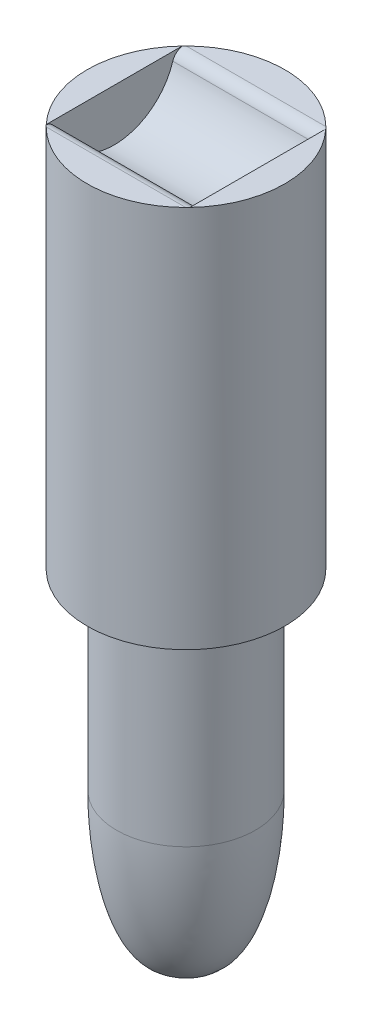
from build123d import *

# Parameters (mm, degrees)
SKETCH1_R               = 1.45
BOSS_EXTRUDE1_DEPTH     = 7
SKETCH3_R               = 2.065
BOSS_EXTRUDE3_DEPTH     = 8
FILLET1_SIZE            = 3
FILLET1_SIZE_2          = 1
CUT_EXTRUDE1_DEPTH      = 1.5
CUT_EXTRUDE1_DEPTH_BACK = 1.5
SKETCH5_R               = 1.280712692
FILLET2_R               = 0.25


with BuildPart() as part:
    # Sketch1 → Boss-Extrude1 (new body)
    with BuildSketch(Plane(origin=(0, 0, 0), x_dir=(1, 0, 0), z_dir=(0, 1, 0))):
        with Locations(Location((0, 0, 0), (0, 0, 270))):
            Circle(SKETCH1_R)
    extrude(amount=BOSS_EXTRUDE1_DEPTH)

    # Sketch3 → Boss-Extrude3 (add)
    with BuildSketch(Plane(origin=(0, 7, 0), x_dir=(1, 0, 0), z_dir=(0, 1, 0))):
        with Locations(Location((0, 0, 0), (0, 0, 270))):
            Circle(SKETCH3_R)
    extrude(amount=BOSS_EXTRUDE3_DEPTH)

    # Fillet1
    # an asymmetric fillet: 3, 1 mm, written as the material it takes off along each edge
    with BuildSketch(Plane(origin=(0, 0, 0), x_dir=(0, 0, 1), z_dir=(-1, 0, 0))) as fillet1_piece_1:
        with BuildLine():
            Bezier((1.45, FILLET1_SIZE), (1.45, 0), (1.45 - FILLET1_SIZE_2, 0), weights=[1, 0.707106781, 1])
            Line((1.45 - FILLET1_SIZE_2, 0), (1.45, 0))
            Line((1.45, 0), (1.45, FILLET1_SIZE))
        make_face()
    revolve(axis=Axis((0, 0, 0), (0, 1, 0)), mode=Mode.SUBTRACT)

    # Sketch5 → Cut-Extrude1 (cut, two sides: drawn at the far end of the back side and taken through both)
    with BuildSketch(Plane(origin=(0, 0, 0), x_dir=(0, 0, -1), z_dir=(1, 0, 0)).offset(-CUT_EXTRUDE1_DEPTH_BACK)):
        with Locations((0, 15.2)):
            Circle(SKETCH5_R)
    extrude(amount=CUT_EXTRUDE1_DEPTH + CUT_EXTRUDE1_DEPTH_BACK, mode=Mode.SUBTRACT)

    # Fillet2
    # the kernel refuses this fillet: 0.25 mm, written as the material it takes off along each edge
    with BuildSketch(Plane(origin=(1.5, 15, 1.265), x_dir=(0, 0, 1), z_dir=(-1, 0, 0)), Plane(origin=(-1.5, 15, -1.265), x_dir=(0, 0, -1), z_dir=(1, 0, 0))) as fillet2_piece_1:
        with BuildLine():
            CenterArc((0.19807257, -0.25), FILLET2_R, 90, 72.903573808)
            Line((-0.040880268, -0.176504823), (-0.045659325, -0.17503492))
            ThreePointArc((-0.045659325, -0.17503492), (-0.022186102, -0.087848028), (-0.004938656, 0.000780815))
            Line((-0.004938656, 0.000780815), (0, 0.005))
            Line((0, 0.005), (0.19807257, 0.005))
            Line((0.19807257, 0.005), (0.19807257, 0))
        make_face()
    extrude(amount=3, mode=Mode.SUBTRACT)


solid = part.part
